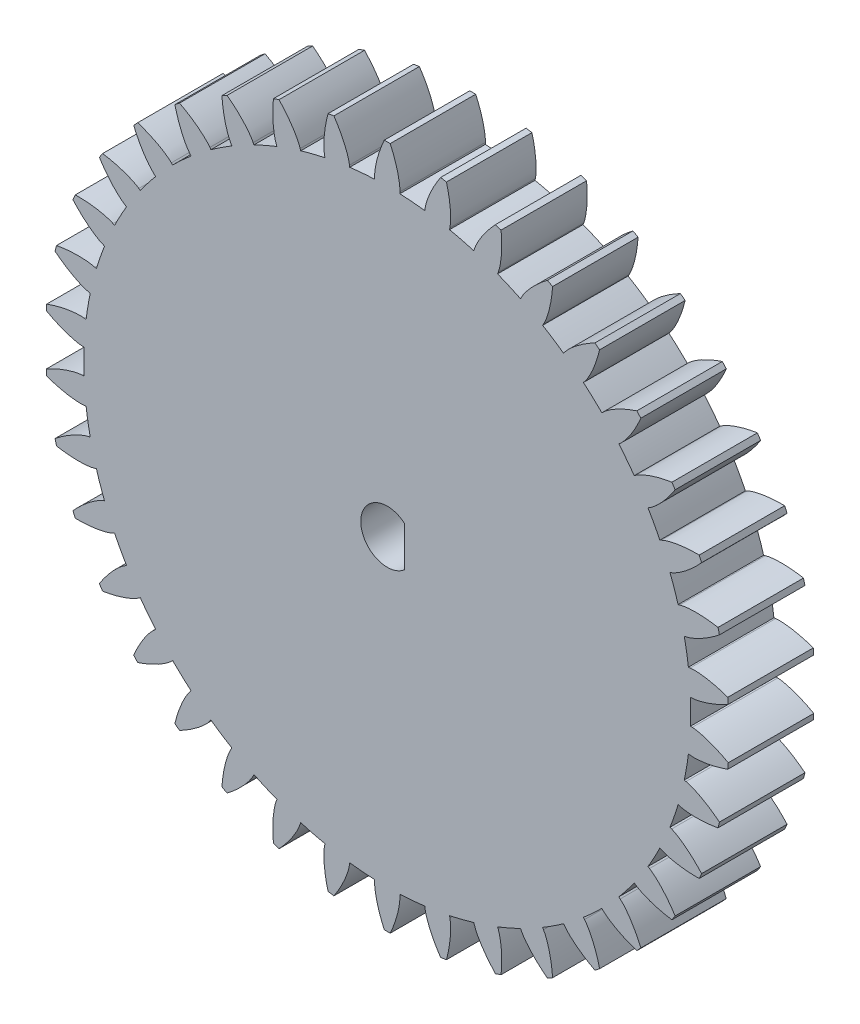
from build123d import *

# Parameters (mm, degrees)
SKETCH_1_R                       = 5
SKETCH_1_R_2                     = 1.5
EXTRUDE_1_DEPTH                  = 5
CUT_EXTRUDE_1_DEPTH              = 9.660254038
FILLET_1_R                       = 0.5
PATTERN_CIRCULAR_1_COUNT         = 8
PATTERN_CIRCULAR_1_ANGLE         = 315
FILLET_1_OF_PATTERN_CIRCULAR_1_R = 0.5
SKETCH_2_R                       = 20
SKETCH_2_R_2                     = 1.5
EXTRUDE_2_DEPTH                  = 5
CUT_EXTRUDE_3_DEPTH              = 29.722813389
PATTERN_CIRCULAR_2_COUNT         = 38
SKETCH_3_R                       = 1.55
EXTRUDE_3_DEPTH                  = 10
CUT_EXTRUDE_4_DEPTH              = 30.963536777


with BuildPart() as part:
    # 草图1 → 凸台-拉伸1 (new body)
    with BuildSketch(Plane.XY):
        Circle(SKETCH_1_R)
        Circle(SKETCH_1_R_2, mode=Mode.SUBTRACT)
    extrude(amount=EXTRUDE_1_DEPTH)

    # 草图1<3> → 切除-拉伸1 (cut, through all)
    with BuildSketch(Plane.XY):
        with BuildLine():
            Line((3.694052861, 0.694499102), (2.70265115, 0.508110974))
            ThreePointArc((2.70265115, 0.508110974), (2.738137201, 0.255156165), (2.75, 0))
            ThreePointArc((2.75, 0), (2.738137201, -0.255156165), (2.70265115, -0.508110974))
            Line((2.70265115, -0.508110974), (3.694052861, -0.694499102))
            add(Edge.make_bspline(
                [(3.694052861, -0.694499102), (3.722211627, -0.699793081), (3.799693178, -0.720419243), (3.940318318, -0.782609443), (4.152220935, -0.913709849), (4.396753171, -1.123866204), (4.57470903, -1.327029126), (4.691039069, -1.485797488), (4.747245846, -1.569604051)],
                knots=[0, 0, 0, 0, 0, 0.005604068, 0.015718248, 0.029959916, 0.048733667, 0.068515916, 0.068515916, 0.068515916, 0.068515916, 0.068515916], degree=4))
            ThreePointArc((4.747245846, -1.569604051), (4.936407055, -0.794912187), (5, 0))
            ThreePointArc((5, 0), (4.936407055, 0.794912187), (4.747245846, 1.569604051))
            add(Edge.make_bspline(
                [(3.694052861, 0.694499102), (3.722211627, 0.699793081), (3.799693178, 0.720419243), (3.940318318, 0.782609443), (4.152220935, 0.913709849), (4.396753171, 1.123866204), (4.57470903, 1.327029126), (4.691039069, 1.485797488), (4.747245846, 1.569604051)],
                knots=[0, 0, 0, 0, 0, 0.005604068, 0.015718248, 0.029959916, 0.048733667, 0.068515916, 0.068515916, 0.068515916, 0.068515916, 0.068515916], degree=4))
        make_face()
    cut_extrude_1 = extrude(amount=CUT_EXTRUDE_1_DEPTH, mode=Mode.SUBTRACT)

    # 圆角1
    fillet_1_edges = [part.edges().sort_by_distance(p)[0] for p in [
        (2.70265115, -0.508110974, 2.5),
        (4.747245846, -1.569604051, 2.5),
        (4.747245846, 1.569604051, 2.5),
        (2.70265115, 0.508110974, 2.5),
    ]]
    fillet(fillet_1_edges, radius=FILLET_1_R)

    # 阵列(圆周)1: 切除-拉伸1 ×8 about axis
    pattern_circular_1_axis = Axis((0, 0, 5), (0, 0, 1))
    for i in range(1, PATTERN_CIRCULAR_1_COUNT):
        add(cut_extrude_1.rotate(pattern_circular_1_axis, i * PATTERN_CIRCULAR_1_ANGLE / (PATTERN_CIRCULAR_1_COUNT - 1)), mode=Mode.SUBTRACT)

    # 圆角1 of 阵列(圆周)1
    fillet_1_of_pattern_circular_1_edges = [part.edges().sort_by_distance(p)[0] for p in [
        (2.27035167, 1.55177424, 2.5),
        (4.466687398, 2.246932061, 2.5),
        (2.246932061, 4.466687398, 2.5),
        (1.55177424, 2.27035167, 2.5),
        (0.508110974, 2.70265115, 2.5),
        (1.569604051, 4.747245846, 2.5),
        (-1.569604051, 4.747245846, 2.5),
        (-0.508110974, 2.70265115, 2.5),
        (-1.55177424, 2.27035167, 2.5),
        (-2.246932061, 4.466687398, 2.5),
        (-4.466687398, 2.246932061, 2.5),
        (-2.27035167, 1.55177424, 2.5),
        (-2.70265115, 0.508110974, 2.5),
        (-4.747245846, 1.569604051, 2.5),
        (-4.747245846, -1.569604051, 2.5),
        (-2.70265115, -0.508110974, 2.5),
        (-2.27035167, -1.55177424, 2.5),
        (-4.466687398, -2.246932061, 2.5),
        (-2.246932061, -4.466687398, 2.5),
        (-1.55177424, -2.27035167, 2.5),
        (-0.508110974, -2.70265115, 2.5),
        (-1.569604051, -4.747245846, 2.5),
        (1.569604051, -4.747245846, 2.5),
        (0.508110974, -2.70265115, 2.5),
        (1.55177424, -2.27035167, 2.5),
        (2.246932061, -4.466687398, 2.5),
        (4.466687398, -2.246932061, 2.5),
        (2.27035167, -1.55177424, 2.5),
    ]]
    fillet(fillet_1_of_pattern_circular_1_edges, radius=FILLET_1_OF_PATTERN_CIRCULAR_1_R)

    # 草图2 → 凸台-拉伸2 (add)
    with BuildSketch(Plane.XY.offset(5)):
        Circle(SKETCH_2_R)
        Circle(SKETCH_2_R_2, mode=Mode.SUBTRACT)
    extrude(amount=EXTRUDE_2_DEPTH)

    # 草图2<3> → 切除-拉伸3 (cut, through all)
    with BuildSketch(Plane.XY.offset(5)):
        with BuildLine():
            Line((17.838908029, 0.737822694), (17.734837211, 0.733518293))
            ThreePointArc((17.734837211, 0.733518293), (17.746208898, 0.366837497), (17.75, 0))
            ThreePointArc((17.75, 0), (17.746208898, -0.366837497), (17.734837211, -0.733518293))
            Line((17.734837211, -0.733518293), (17.838908029, -0.737822694))
            add(Edge.make_bspline(
                [(17.838908029, -0.737822694), (17.872849269, -0.739226514), (17.940552494, -0.744118754), (18.075241986, -0.762138409), (18.328810536, -0.812273342), (18.66347973, -0.90508771), (19.120548858, -1.070237387), (19.508851941, -1.247313895), (19.778857482, -1.386865325), (19.937601681, -1.474433608), (19.945263252, -1.478672992)],
                knots=[0, 0, 0, 0, 0, 0.001401017, 0.002802034, 0.005604068, 0.010661158, 0.015718248, 0.022839082, 0.023200461, 0.023200461, 0.023200461, 0.023200461, 0.023200461], degree=4))
            ThreePointArc((19.945263252, -1.478672992), (19.986311128, -0.739842877), (20, 0))
            ThreePointArc((20, 0), (19.986311128, 0.739842877), (19.945263252, 1.478672992))
            add(Edge.make_bspline(
                [(17.838908029, 0.737822694), (17.872849269, 0.739226514), (17.940552494, 0.744118754), (18.075241986, 0.762138409), (18.328810536, 0.812273342), (18.66347973, 0.90508771), (19.120548858, 1.070237387), (19.508851941, 1.247313895), (19.778857482, 1.386865325), (19.937601681, 1.474433608), (19.945263252, 1.478672992)],
                knots=[0, 0, 0, 0, 0, 0.001401017, 0.002802034, 0.005604068, 0.010661158, 0.015718248, 0.022839082, 0.023200461, 0.023200461, 0.023200461, 0.023200461, 0.023200461], degree=4))
        make_face()
    cut_extrude_3 = extrude(amount=CUT_EXTRUDE_3_DEPTH, mode=Mode.SUBTRACT)

    # 阵列(圆周)2: 切除-拉伸3 ×38 about axis
    pattern_circular_2_axis = Axis((0, 0, 10), (0, 0, 1))
    for i in range(1, PATTERN_CIRCULAR_2_COUNT):
        add(cut_extrude_3.rotate(pattern_circular_2_axis, i * 360 / PATTERN_CIRCULAR_2_COUNT), mode=Mode.SUBTRACT)

    # 草图3 → 凸台-拉伸3 (add, through all)
    with BuildSketch(Plane(origin=(0, 0, 0), x_dir=(-1, 0, 0), z_dir=(0, 0, -1))):
        Circle(SKETCH_3_R)
    extrude(amount=-EXTRUDE_3_DEPTH)

    # 草图3<3> → 切除-拉伸4 (cut, through all)
    with BuildSketch(Plane(origin=(0, 0, 0), x_dir=(-1, 0, 0), z_dir=(0, 0, -1))):
        with BuildLine():
            Line((-1, 1.184271928), (-1, -1.184271928))
            ThreePointArc((-1, -1.184271928), (0.652878243, -1.405791592), (1.55, 0))
            ThreePointArc((1.55, 0), (0.652878243, 1.405791592), (-1, 1.184271928))
        make_face()
    extrude(amount=-CUT_EXTRUDE_4_DEPTH, mode=Mode.SUBTRACT)


solid = part.part
